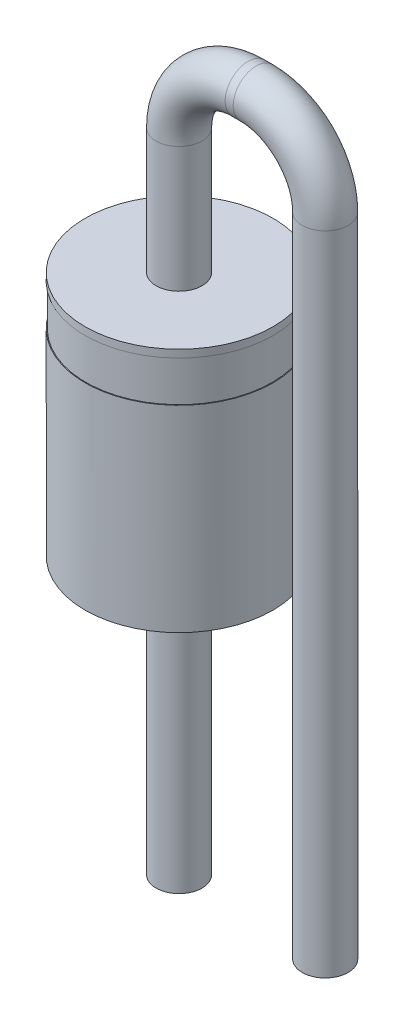
from build123d import *

# Parameters (mm, degrees)
SKETCH1_R     = 1.225
BODY_DEPTH    = 1.6
CATHODE_START = 0.1
SKETCH8_R     = 1.235
SKETCH8_R_2   = 1.215
CATHODE_DEPTH = 0.533333333
SKETCH6_R     = 0.3


with BuildPart() as part:
    # Sketch1 → BODY (new, symmetric)
    with BuildSketch(Plane(origin=(0, 2.6, 0), x_dir=(1, 0, 0), z_dir=(0, 1, 0))):
        Circle(SKETCH1_R)
    extrude(amount=BODY_DEPTH, both=True)

    # Sketch8 → CATHODE (cut)
    with BuildSketch(Plane(origin=(0, 4.2, 0), x_dir=(0, 0, 1), z_dir=(0, -1, 0)).offset(CATHODE_START)):
        Circle(SKETCH8_R)
        Circle(SKETCH8_R_2, mode=Mode.SUBTRACT)
    extrude(amount=CATHODE_DEPTH, mode=Mode.SUBTRACT)

    # PINS: sweep along a path in Sketch7
    with BuildLine(Plane.XY) as pins_path:
        Line((0, -2.6), (0, 5.833783306))
        ThreePointArc((0, 5.833783306), (0.263603897, 6.470179409), (0.9, 6.733783306))
        Line((0.9, 6.733783306), (1.005, 6.733783306))
        ThreePointArc((1.005, 6.733783306), (1.641396103, 6.470179409), (1.905, 5.833783306))
        Line((1.905, 5.833783306), (1.905, -2.6))
    # Sketch6 → PINS (sweep)
    with BuildSketch(Plane(origin=(0, 2.6, 0), x_dir=(1, 0, 0), z_dir=(0, 1, 0))):
        Circle(SKETCH6_R)
    sweep(path=pins_path.line)


solid = part.part
